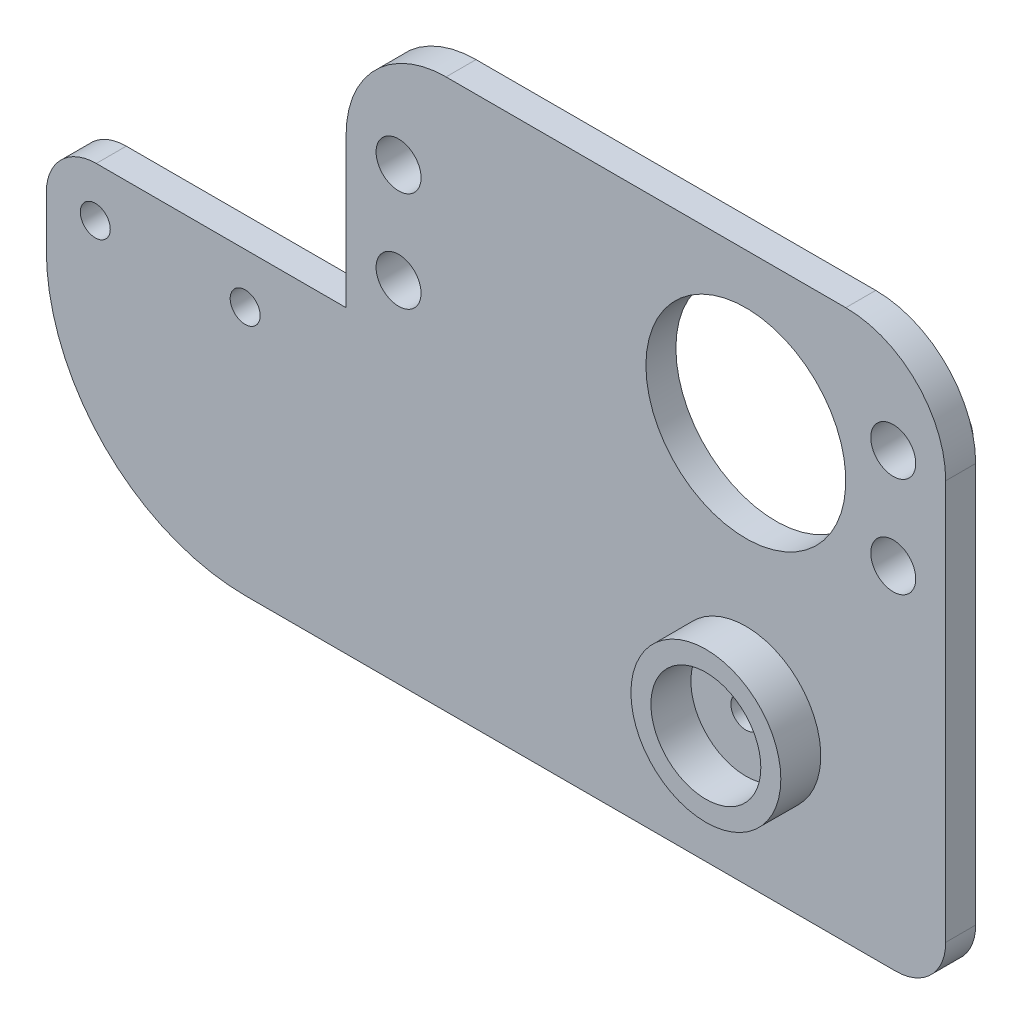
from build123d import *

# Parameters (mm, degrees)
SKETCH_3_R               = 3
EXTRUDE_6_DEPTH          = 2
EXTRUDE_6_2_DEPTH        = 2
EXTRUDE_6_3_DEPTH        = 2
EXTRUDE_6_4_DEPTH        = 2
CUT_EXTRUDE_2_DEPTH      = 10
CUT_EXTRUDE_2_DEPTH_BACK = 2
SKETCH_11_R              = 2.25
EXTRUDE_7_DEPTH          = 3
CUT_EXTRUDE_START        = -3
SKETCH_14_R              = 2.25
SKETCH_14_R_2            = 10
CUT_EXTRUDE_3_DEPTH      = 3
SKETCH_15_R              = 10
SKETCH_15_R_2            = 1.5
CUT_EXTRUDE_4_DEPTH      = 3
FILLET_3_R               = 5
FILLET_4_R               = 10
SKETCH_16_R              = 1.5
CUT_EXTRUDE_5_DEPTH      = 10
FILLET_5_R               = 20
SKETCH_17_R              = 7.5
SKETCH_17_R_2            = 5.5
EXTRUDE_8_DEPTH          = 4


with BuildPart() as part:
    # 草图3 → 凸台-拉伸6 (new body)
    with BuildSketch(Plane.XY):
        with Locations((60.266478541, 16.532501821)):
            Circle(SKETCH_3_R)
    extrude(amount=EXTRUDE_6_DEPTH)


with BuildPart() as body_2:
    # 草图3 → Extrude 6 2 (new body)
    with BuildSketch(Plane.XY):
        with Locations((60.266478541, 6.532501821)):
            Circle(SKETCH_3_R)
    extrude(amount=EXTRUDE_6_2_DEPTH)


with BuildPart() as body_3:
    # 草图3 → Extrude 6 3 (new body)
    with BuildSketch(Plane.XY):
        with Locations((10.766478541, 6.532501821)):
            Circle(SKETCH_3_R)
    extrude(amount=EXTRUDE_6_3_DEPTH)


with BuildPart() as body_4:
    # 草图3 → Extrude 6 4 (new body)
    with BuildSketch(Plane.XY):
        with Locations((10.766478541, 16.532501821)):
            Circle(SKETCH_3_R)
    extrude(amount=EXTRUDE_6_4_DEPTH)


with BuildPart() as cut_extrude_2_tool:
    # 草图11 → 切除-拉伸2 (new, two sides: drawn at the far end of the back side and taken through both)
    with BuildSketch(Plane.XY.offset(2).offset(-CUT_EXTRUDE_2_DEPTH_BACK)):
        with Locations((10.766478541, 16.532501821)):
            Circle(SKETCH_11_R)
        with Locations((10.766478541, 6.532501821)):
            Circle(SKETCH_11_R)
        with Locations((60.266478541, 16.532501821)):
            Circle(SKETCH_11_R)
        with Locations((60.266478541, 6.532501821)):
            Circle(SKETCH_11_R)
    extrude(amount=CUT_EXTRUDE_2_DEPTH + CUT_EXTRUDE_2_DEPTH_BACK)


with BuildPart() as part_1:
    add(part.part)

    # 切除-拉伸2: cut by cut_extrude_2_tool
    add(cut_extrude_2_tool.part, mode=Mode.SUBTRACT)



with BuildPart() as body_2_1:
    add(body_2.part)

    # 切除-拉伸2: cut by cut_extrude_2_tool
    add(cut_extrude_2_tool.part, mode=Mode.SUBTRACT)


with BuildPart() as body_3_1:
    add(body_3.part)

    # 切除-拉伸2: cut by cut_extrude_2_tool
    add(cut_extrude_2_tool.part, mode=Mode.SUBTRACT)


with BuildPart() as body_4_1:
    add(body_4.part)

    # 切除-拉伸2: cut by cut_extrude_2_tool
    add(cut_extrude_2_tool.part, mode=Mode.SUBTRACT)


with BuildPart() as part_2:
    add(part_1.part)

    add(body_2_1.part)  # 凸台-拉伸7 merges body 2

    add(body_3_1.part)  # 凸台-拉伸7 merges body 3

    add(body_4_1.part)  # 凸台-拉伸7 merges body 4
    # 草图12 → 凸台-拉伸7 (add)
    with BuildSketch(Plane.XY.offset(2)):
        Polygon((5.516478541, 26.532501821), (65.516478541, 26.532501821), (65.516478541, -28.467498179), (5.516478541, -28.467498179), (-24.483521459, -28.467498179), (-24.483521459, 1.532501821), (5.516478541, 1.532501821), align=None)
    extrude(amount=EXTRUDE_7_DEPTH)

    # 草图14 → 切除-拉伸3 (cut)
    with BuildSketch(Plane(origin=(0, 0, 2), x_dir=(-1, 0, 0), z_dir=(0, 0, -1)).offset(CUT_EXTRUDE_START)):
        with Locations((-60.266478541, 6.532501821)):
            Circle(SKETCH_14_R)
        with Locations((-60.266478541, 16.532501821)):
            Circle(SKETCH_14_R)
        with Locations((-10.766478541, 6.532501821)):
            Circle(SKETCH_14_R)
        with Locations((-10.766478541, 16.532501821)):
            Circle(SKETCH_14_R)
        with Locations((-45.516478541, 11.532501821)):
            Circle(SKETCH_14_R_2)
    extrude(amount=CUT_EXTRUDE_3_DEPTH, mode=Mode.SUBTRACT)

    # 草图15 → 切除-拉伸4 (cut)
    with BuildSketch(Plane(origin=(0, 0, 2), x_dir=(-1, 0, 0), z_dir=(0, 0, -1)).offset(CUT_EXTRUDE_START)):
        with Locations((-45.516478541, 11.532501821)):
            Circle(SKETCH_15_R)
        with Locations((-45.516478541, -13.567498179)):
            Circle(SKETCH_15_R_2)
    extrude(amount=CUT_EXTRUDE_4_DEPTH, mode=Mode.SUBTRACT)

    # 圆角3
    fillet_3_edges = [part_2.edges().sort_by_distance(p)[0] for p in [
        (65.516478541, -28.467498179, 3.5),
        (-24.483521459, 1.532501821, 3.5),
    ]]
    fillet(fillet_3_edges, radius=FILLET_3_R)

    # 圆角4
    fillet_4_edges = [part_2.edges().sort_by_distance(p)[0] for p in [
        (65.516478541, 26.532501821, 3.5),
        (5.516478541, 26.532501821, 3.5),
    ]]
    fillet(fillet_4_edges, radius=FILLET_4_R)

    # 草图16 → 切除-拉伸5 (cut)
    with BuildSketch(Plane.XY.offset(5)):
        with Locations((-19.583521459, -3.467498179)):
            Circle(SKETCH_16_R)
        with Locations((-4.583521459, -3.467498179)):
            Circle(SKETCH_16_R)
    extrude(amount=-CUT_EXTRUDE_5_DEPTH, mode=Mode.SUBTRACT)

    # 圆角5
    fillet_5_edges = [part_2.edges().sort_by_distance(p)[0] for p in [
        (-24.483521459, -28.467498179, 3.5),
    ]]
    fillet(fillet_5_edges, radius=FILLET_5_R)

    # 草图17 → 凸台-拉伸8 (add)
    with BuildSketch(Plane.XY.offset(5)):
        with Locations((45.516478541, -13.567498179)):
            Circle(SKETCH_17_R)
        with Locations((45.516478541, -13.567498179)):
            Circle(SKETCH_17_R_2, mode=Mode.SUBTRACT)
    extrude(amount=EXTRUDE_8_DEPTH)


solid = part_2.part
